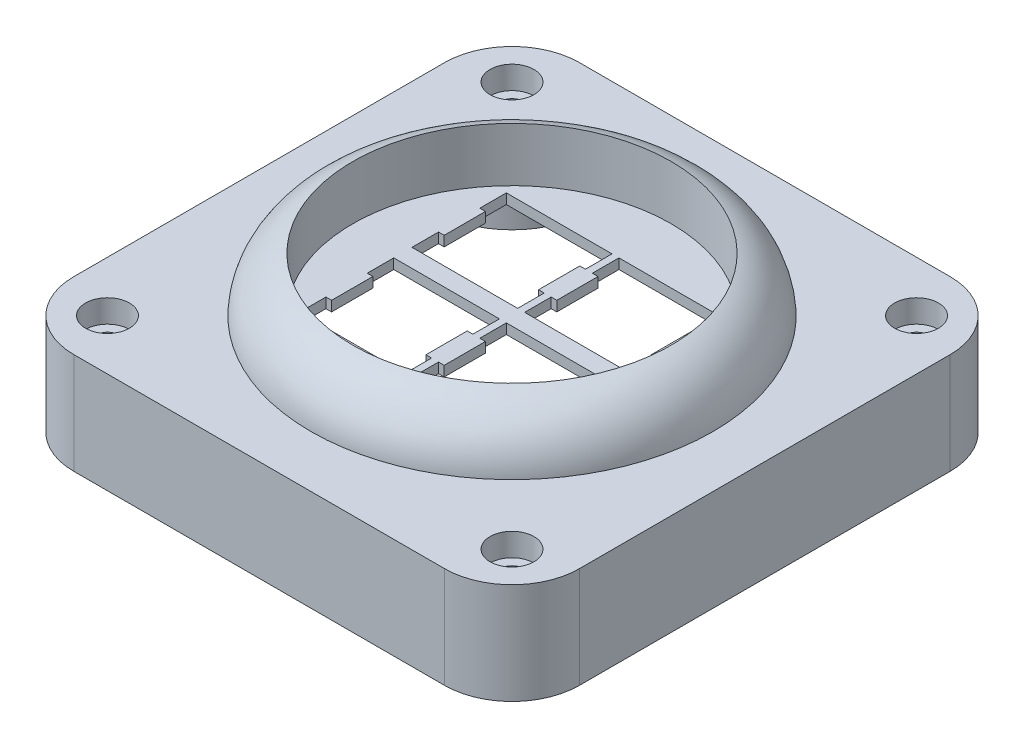
from build123d import *

# Parameters (mm, degrees)
SKIZZE1_R                                            = 1.6
AUFSATZ_LINEAR_AUSTRAGEN1_DEPTH                      = 15
AUFSATZ_LINEAR_AUSTRAGEN2_DEPTH                      = 1.5
VERRUNDUNG1_R                                        = 10
VERRUNDUNG2_R                                        = 12
STIRNSENKUNG_F_R_M3_ZYLINDERSCHRAUBE_MIT_D           = 3.6
STIRNSENKUNG_F_R_M3_ZYLINDERSCHRAUBE_MIT_CBORE_D     = 6.5
STIRNSENKUNG_F_R_M3_ZYLINDERSCHRAUBE_MIT_CBORE_DEPTH = 3.4


with BuildPart() as part:
    # Skizze1 → Aufsatz-Linear austragen1 (new body)
    with BuildSketch(Plane(origin=(0, 0, 0), x_dir=(1, 0, 0), z_dir=(0, 1, 0))):
        Polygon((-37.5, 22.5), (-37.5, -37.5), (37.5, -37.5), (37.5, 37.5), (-35, 37.5), (-37.5, 37.5), align=None)
        with Locations(Location((-30, -30, 0), (0, 0, 270))):
            Circle(SKIZZE1_R, mode=Mode.SUBTRACT)
        with Locations(Location((30, -30, 0), (0, 0, 270))):
            Circle(SKIZZE1_R, mode=Mode.SUBTRACT)
        with Locations(Location((-30, 30, 0), (0, 0, 270))):
            Circle(SKIZZE1_R, mode=Mode.SUBTRACT)
        Polygon((-22.5, 22.5), (-22.5, 34.5), (22.5, 34.5), (22.5, 22.5), (34.5, 22.5), (34.5, -22.5), (22.5, -22.5), (22.5, -34.5), (-22.5, -34.5), (-22.5, -22.5), (-34.5, -22.5), (-34.5, 22.5), align=None, mode=Mode.SUBTRACT)
        with Locations(Location((30, 30, 0), (0, 0, 270))):
            Circle(SKIZZE1_R, mode=Mode.SUBTRACT)
    extrude(amount=-AUFSATZ_LINEAR_AUSTRAGEN1_DEPTH)

    # Skizze1<3> → Aufsatz-Linear austragen2 (add)
    with BuildSketch(Plane(origin=(0, 0, 0), x_dir=(1, 0, 0), z_dir=(0, 1, 0))):
        Polygon((22.5, 34.5), (-22.5, 34.5), (-22.5, 22.5), (-34.5, 22.5), (-34.5, -22.5), (-22.5, -22.5), (-22.5, -34.5), (22.5, -34.5), (22.5, -22.5), (34.5, -22.5), (34.5, 22.5), (22.5, 22.5), align=None)
        Polygon((-0.51468496, -5.28988496), (-1.35288496, -5.28988496), (-1.35288496, -11.41128496), (-0.51468496, -11.41128496), (-0.51468496, -15.34828496), (-1.35288496, -15.34828496), (-15.34828496, -15.34828496), (-16.18648496, -15.34828496), (-16.18648496, -11.41128496), (-15.34828496, -11.41128496), (-15.34828496, -5.28988496), (-16.18648496, -5.28988496), (-16.18648496, -1.35288496), (-15.34828496, -1.35288496), (-1.35288496, -1.35288496), (-0.51468496, -1.35288496), align=None, mode=Mode.SUBTRACT)
        Polygon((15.34828496, -15.34828496), (1.35288496, -15.34828496), (0.51468496, -15.34828496), (0.51468496, -11.41128496), (1.35288496, -11.41128496), (1.35288496, -5.28988496), (0.51468496, -5.28988496), (0.51468496, -1.35288496), (1.35288496, -1.35288496), (15.34828496, -1.35288496), (16.18648496, -1.35288496), (16.18648496, -5.28988496), (15.34828496, -5.28988496), (15.34828496, -11.41128496), (16.18648496, -11.41128496), (16.18648496, -15.34828496), align=None, mode=Mode.SUBTRACT)
        Polygon((-15.34828496, 15.34828496), (-1.35288496, 15.34828496), (-0.51468496, 15.34828496), (-0.51468496, 11.41128496), (-1.35288496, 11.41128496), (-1.35288496, 5.28988496), (-0.51468496, 5.28988496), (-0.51468496, 1.35288496), (-1.35288496, 1.35288496), (-15.34828496, 1.35288496), (-16.18648496, 1.35288496), (-16.18648496, 5.28988496), (-15.34828496, 5.28988496), (-15.34828496, 11.41128496), (-16.18648496, 11.41128496), (-16.18648496, 15.34828496), align=None, mode=Mode.SUBTRACT)
        Polygon((0.51468496, 5.28988496), (1.35288496, 5.28988496), (1.35288496, 11.41128496), (0.51468496, 11.41128496), (0.51468496, 15.34828496), (1.35288496, 15.34828496), (15.34828496, 15.34828496), (16.18648496, 15.34828496), (16.18648496, 11.41128496), (15.34828496, 11.41128496), (15.34828496, 5.28988496), (16.18648496, 5.28988496), (16.18648496, 1.35288496), (15.34828496, 1.35288496), (1.35288496, 1.35288496), (0.51468496, 1.35288496), align=None, mode=Mode.SUBTRACT)
    extrude(amount=-AUFSATZ_LINEAR_AUSTRAGEN2_DEPTH)

    # Verrundung1
    verrundung1_edges = [part.edges().sort_by_distance(p)[0] for p in [
        (37.5, -7.5, -37.5),
        (37.5, -7.5, 37.5),
        (-37.5, -7.5, 37.5),
        (-37.5, -7.5, -37.5),
    ]]
    fillet(verrundung1_edges, radius=VERRUNDUNG1_R)

    # Verrundung2
    verrundung2_edges = [part.edges().sort_by_distance(p)[0] for p in [
        (22.5, -8.25, 22.5),
        (-22.5, -8.25, 22.5),
        (22.5, -8.25, -22.5),
        (-22.5, -8.25, -22.5),
    ]]
    fillet(verrundung2_edges, radius=VERRUNDUNG2_R - 0.0001)  # a hair under: the kernel refuses the full size

    # Skizze3 → Rotation1 (revolve)
    with BuildSketch(Plane(origin=(0, 0, 0), x_dir=(0, 0, -1), z_dir=(1, 0, 0))):
        with BuildLine():
            Line((23.608930659, 0), (29.803663871, 0))
            ThreePointArc((29.803663871, 0), (27.936560085, 4.952643744), (23.608930659, 8))
            Line((23.608930659, 8), (23.608930659, 0))
        make_face()
    revolve(axis=Axis((0, 0, 0), (0, 1, 0)))

    # Stirnsenkung für M3 Zylinderschraube mit Innensechskant1 (through all)
    with Locations(Plane(origin=(0, 0, 0), x_dir=(1, 0, 0), z_dir=(0, 1, 0))):
        with Locations((-30, 30), (30, 30), (-30, -30), (30, -30)):
            CounterBoreHole(STIRNSENKUNG_F_R_M3_ZYLINDERSCHRAUBE_MIT_D / 2, STIRNSENKUNG_F_R_M3_ZYLINDERSCHRAUBE_MIT_CBORE_D / 2, STIRNSENKUNG_F_R_M3_ZYLINDERSCHRAUBE_MIT_CBORE_DEPTH)


solid = part.part
